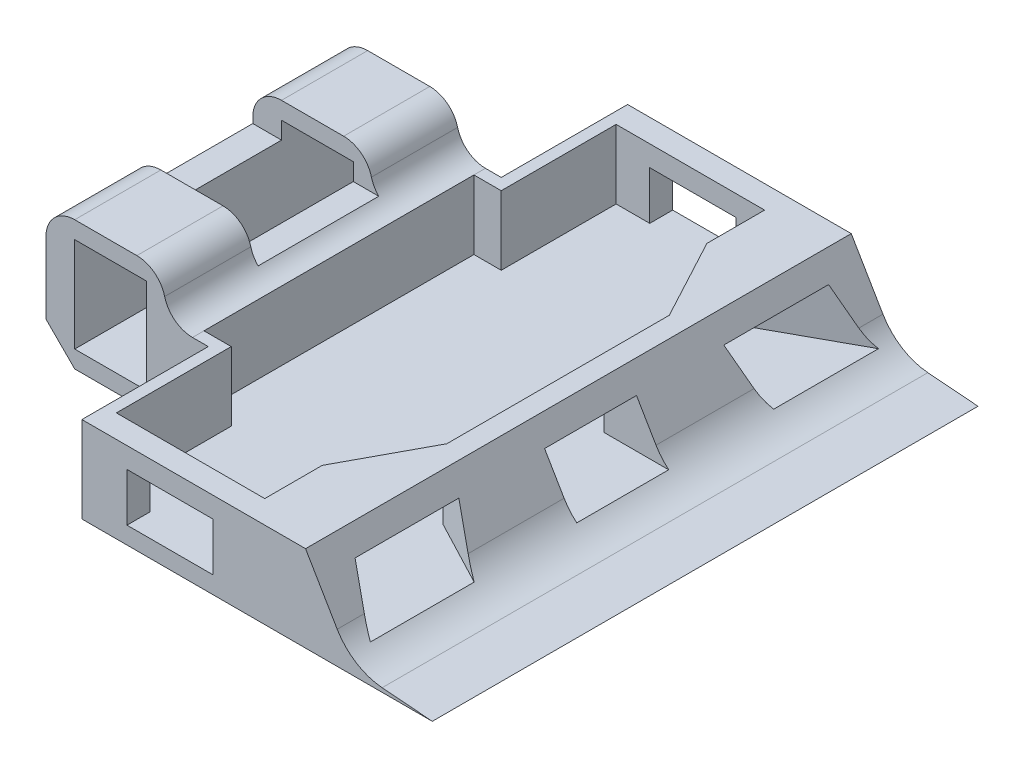
from build123d import *

# Parameters (mm, degrees)
SKETCH1_W                = 95
SKETCH1_H                = 95
BOSS_EXTRUDE1_DEPTH      = 20
SKETCH2_W                = 15
SKETCH2_H                = 8.4
CUT_EXTRUDE1_DEPTH       = 50
CUT_EXTRUDE3_DEPTH       = 100
FILLET1_R                = 10
CUT_EXTRUDE4_DEPTH       = 17
SKETCH8_W                = 15
SKETCH8_H                = 8.4
CUT_EXTRUDE5_DEPTH       = 4
SKETCH9_W                = 15
SKETCH9_H                = 8.4
CUT_EXTRUDE6_DEPTH       = 4
SKETCH10_W               = 15
SKETCH10_H               = 8.4
CUT_EXTRUDE7_DEPTH       = 100
SKETCH11_W               = 15
SKETCH11_H               = 8.4
CUT_EXTRUDE8_DEPTH       = 100
SKETCH12_W               = 96.22761595
SKETCH12_H               = 5
CUT_EXTRUDE9_DEPTH       = 100
SKETCH14_W               = 16
SKETCH14_H               = 8.4
CUT_EXTRUDE10_DEPTH      = 100
SKETCH15_W               = 16
SKETCH15_H               = 8.4
CUT_EXTRUDE11_DEPTH      = 100
SKETCH16_W               = 16
SKETCH16_H               = 8.4
CUT_EXTRUDE13_DEPTH      = 100
CUT_EXTRUDE16_DEPTH      = 12
SKETCH21_W               = 23.779532914
SKETCH21_H               = 2
BOSS_EXTRUDE2_DEPTH      = 12
SKETCH23_W               = 23.759878039
SKETCH23_H               = 2
BOSS_EXTRUDE3_DEPTH      = 12
CUT_EXTRUDE19_DEPTH      = 100
CUT_EXTRUDE19_DEPTH_BACK = 100
SKETCH24_W               = 15
SKETCH24_H               = 8.4
SKETCH26_W               = 20
SKETCH26_H               = 95
BOSS_EXTRUDE4_DEPTH      = 20
SKETCH31_W               = 95
SKETCH31_H               = 20
BOSS_EXTRUDE6_DEPTH      = 10
SKETCH32_W               = 12.5
SKETCH32_H               = 16.5
CUT_EXTRUDE22_DEPTH      = 100
SKETCH33_W               = 3.75
SKETCH33_H               = 20
CUT_EXTRUDE23_DEPTH      = 100
SKETCH34_W               = 26.25
SKETCH34_H               = 12.5
CUT_EXTRUDE24_DEPTH      = 100
SKETCH35_W               = 34
SKETCH35_H               = 47.07285681
CUT_EXTRUDE25_DEPTH      = 22
SKETCH36_W               = 34
SKETCH36_H               = 30.604426896
CUT_EXTRUDE26_DEPTH      = 22
SKETCH37_W               = 26.25
SKETCH37_H               = 21
CUT_EXTRUDE28_DEPTH      = 6
SKETCH38_W               = 5.75
SKETCH38_H               = 22.5
CUT_EXTRUDE29_DEPTH      = 100
CHAMFER1_SIZE            = 5
SKETCH39_W               = 2.070576792
SKETCH39_H               = 87
CUT_EXTRUDE30_DEPTH      = 12
FILLET4_R                = 5
FILLET5_R                = 5
SKETCH40_W               = 4.75
SKETCH40_H               = 47
CUT_EXTRUDE31_DEPTH      = 12
FILLET6_R                = 5


with BuildPart() as part:
    # Sketch1 → Boss-Extrude1 (new body)
    with BuildSketch(Plane(origin=(0, 0, 0), x_dir=(1, 0, 0), z_dir=(0, 1, 0))):
        with Locations((-2.165031067, 2.677660124)):
            Rectangle(SKETCH1_W, SKETCH1_H)
    extrude(amount=BOSS_EXTRUDE1_DEPTH)

    # Sketch2 → Cut-Extrude1 (cut)
    with BuildSketch(Plane(origin=(45.334968933, 0, 0), x_dir=(0, 0, -1), z_dir=(1, 0, 0))):
        with Locations((2.677660124, 7.2)):
            Rectangle(SKETCH2_W, SKETCH2_H)
    extrude(amount=-CUT_EXTRUDE1_DEPTH, mode=Mode.SUBTRACT)

    # Sketch6 → Cut-Extrude3 (cut)
    with BuildSketch(Plane.XY.offset(44.822339876)):
        Polygon((45.334968933, 0), (31.416327077, 1.119733542), (20.334968933, 20), (45.334968933, 20), align=None)
    extrude(amount=-CUT_EXTRUDE3_DEPTH, mode=Mode.SUBTRACT)

    # Fillet1
    # the kernel refuses this fillet: 10 mm, written as the material it adds along each edge
    with BuildSketch(Plane(origin=(31.416327077, 1.119733542, 44.822339876), x_dir=(0.9967796443594351, -0.08018940447888392, 0), z_dir=(0, 0, -1))) as fillet1_piece_1_section:
        with BuildLine():
            CenterArc((FILLET1_R * 0.52046366993, -FILLET1_R), FILLET1_R, 90, 54.990678882)
            Line((-FILLET1_R * 0.298595051697, -FILLET1_R * 0.426290308146), (0, 0))
            Line((0, 0), (FILLET1_R * 0.52046366993, 0))
        make_face()
    fillet1_piece_1 = extrude(amount=95, mode=Mode.PRIVATE)
    fillet1_piece_1 = split(fillet1_piece_1, bisect_by=Plane(origin=(32.462514907, 1.548685907, 4.822339876), z_dir=(0, 0, 1)), keep=Keep.TOP, mode=Mode.PRIVATE)
    fillet1_piece_1 = split(fillet1_piece_1, bisect_by=Plane(origin=(32.462514907, 3, 24.822339876), z_dir=(0, -1, 0)), keep=Keep.TOP, mode=Mode.PRIVATE)
    add(fillet1_piece_1)
    with BuildSketch(Plane(origin=(31.416327077, 1.119733542, 44.822339876), x_dir=(0.9967796443594351, -0.08018940447888392, 0), z_dir=(0, 0, -1))) as fillet1_piece_2_section:
        with BuildLine():
            CenterArc((FILLET1_R * 0.52046366993, -FILLET1_R), FILLET1_R, 90, 54.990678882)
            Line((-FILLET1_R * 0.298595051697, -FILLET1_R * 0.426290308146), (0, 0))
            Line((0, 0), (FILLET1_R * 0.52046366993, 0))
        make_face()
    fillet1_piece_2 = extrude(amount=95, mode=Mode.PRIVATE)
    fillet1_piece_2 = split(fillet1_piece_2, bisect_by=Plane(origin=(29.780943428, 3.965739863, 4.822339876), z_dir=(0, 0, 1)), keep=Keep.TOP, mode=Mode.PRIVATE)
    fillet1_piece_2 = split(fillet1_piece_2, bisect_by=Plane(origin=(29.780943428, 3, 24.822339876), z_dir=(0, 1, 0)), keep=Keep.TOP, mode=Mode.PRIVATE)
    add(fillet1_piece_2)
    with BuildSketch(Plane(origin=(31.416327077, 1.119733542, 44.822339876), x_dir=(0.9967796443594351, -0.08018940447888392, 0), z_dir=(0, 0, -1))) as fillet1_piece_3_section:
        with BuildLine():
            CenterArc((FILLET1_R * 0.52046366993, -FILLET1_R), FILLET1_R, 90, 54.990678882)
            Line((-FILLET1_R * 0.298595051697, -FILLET1_R * 0.426290308146), (0, 0))
            Line((0, 0), (FILLET1_R * 0.52046366993, 0))
        make_face()
    fillet1_piece_3 = extrude(amount=95, mode=Mode.PRIVATE)
    fillet1_piece_3 = split(fillet1_piece_3, bisect_by=Plane(origin=(32.462514907, 1.548685907, -10.177660124), z_dir=(0, 0, 1)), keep=Keep.TOP, mode=Mode.PRIVATE)
    fillet1_piece_3 = split(fillet1_piece_3, bisect_by=Plane(origin=(32.462514907, 1.548685907, 4.822339876), z_dir=(0, 0, -1)), keep=Keep.TOP, mode=Mode.PRIVATE)
    fillet1_piece_3 = split(fillet1_piece_3, bisect_by=Plane(origin=(32.462514907, 3, -2.677660124), z_dir=(0, -1, 0)), keep=Keep.TOP, mode=Mode.PRIVATE)
    add(fillet1_piece_3)
    with BuildSketch(Plane(origin=(31.416327077, 1.119733542, 44.822339876), x_dir=(0.9967796443594351, -0.08018940447888392, 0), z_dir=(0, 0, -1))) as fillet1_piece_4_section:
        with BuildLine():
            CenterArc((FILLET1_R * 0.52046366993, -FILLET1_R), FILLET1_R, 90, 54.990678882)
            Line((-FILLET1_R * 0.298595051697, -FILLET1_R * 0.426290308146), (0, 0))
            Line((0, 0), (FILLET1_R * 0.52046366993, 0))
        make_face()
    fillet1_piece_4 = extrude(amount=95, mode=Mode.PRIVATE)
    fillet1_piece_4 = split(fillet1_piece_4, bisect_by=Plane(origin=(32.462514907, 1.548685907, -10.177660124), z_dir=(0, 0, -1)), keep=Keep.TOP, mode=Mode.PRIVATE)
    fillet1_piece_4 = split(fillet1_piece_4, bisect_by=Plane(origin=(32.462514907, 3, -30.177660124), z_dir=(0, -1, 0)), keep=Keep.TOP, mode=Mode.PRIVATE)
    add(fillet1_piece_4)
    with BuildSketch(Plane(origin=(31.416327077, 1.119733542, 44.822339876), x_dir=(0.9967796443594351, -0.08018940447888392, 0), z_dir=(0, 0, -1))) as fillet1_piece_5_section:
        with BuildLine():
            CenterArc((FILLET1_R * 0.52046366993, -FILLET1_R), FILLET1_R, 90, 54.990678882)
            Line((-FILLET1_R * 0.298595051697, -FILLET1_R * 0.426290308146), (0, 0))
            Line((0, 0), (FILLET1_R * 0.52046366993, 0))
        make_face()
    fillet1_piece_5 = extrude(amount=95, mode=Mode.PRIVATE)
    fillet1_piece_5 = split(fillet1_piece_5, bisect_by=Plane(origin=(29.780943428, 3.965739863, -10.177660124), z_dir=(0, 0, -1)), keep=Keep.TOP, mode=Mode.PRIVATE)
    fillet1_piece_5 = split(fillet1_piece_5, bisect_by=Plane(origin=(29.780943428, 3, -30.177660124), z_dir=(0, 1, 0)), keep=Keep.TOP, mode=Mode.PRIVATE)
    add(fillet1_piece_5)

    # Sketch7 → Cut-Extrude4 (cut)
    with BuildSketch(Plane(origin=(0, 20, 0), x_dir=(1, 0, 0), z_dir=(0, 1, 0))):
        Polygon((11.360713437, -29.822339876), (18.334968933, -16.542288661), (9.481601456, -11.892784997), (2.50734596, -25.172836212), align=None)
        Polygon((18.334968933, 22.020257336), (11.132000664, 35.177660124), (2.360398805, 30.375681278), (9.563367074, 17.21827849), align=None)
    extrude(amount=-CUT_EXTRUDE4_DEPTH, mode=Mode.SUBTRACT)

    # Sketch8 → Cut-Extrude5 (cut)
    with BuildSketch(Plane(origin=(12.327397833, 0, 6.473952599), x_dir=(0.4649503663833249, 0, -0.885336747684186), z_dir=(0.8853367476841859, 0, 0.4649503663833248))):
        with Locations((-13.620645519, 7.2)):
            Rectangle(SKETCH8_W, SKETCH8_H)
    extrude(amount=-CUT_EXTRUDE5_DEPTH, mode=Mode.SUBTRACT)

    # Sketch9 → Cut-Extrude6 (cut)
    with BuildSketch(Plane(origin=(14.610669282, 0, -7.99855328), x_dir=(-0.48019788460400603, 0, -0.8771601858394155), z_dir=(0.8771601858394155, 0, -0.48019788460400603))):
        with Locations((18.010879722, 7.2)):
            Rectangle(SKETCH9_W, SKETCH9_H)
    extrude(amount=-CUT_EXTRUDE6_DEPTH, mode=Mode.SUBTRACT)

    # Sketch10 → Cut-Extrude7 (cut)
    with BuildSketch(Plane(origin=(8.786050842, 0, 4.614151134), x_dir=(0.464950366383325, 0, -0.8853367476841859), z_dir=(0.8853367476841859, 0, 0.464950366383325))):
        with Locations((-13.620645519, 7.2)):
            Rectangle(SKETCH10_W, SKETCH10_H)
    extrude(amount=CUT_EXTRUDE7_DEPTH, mode=Mode.SUBTRACT)

    # Sketch11 → Cut-Extrude8 (cut)
    with BuildSketch(Plane(origin=(11.102028539, 0, -6.077761742), x_dir=(-0.48019788460400603, 0, -0.8771601858394155), z_dir=(0.8771601858394155, 0, -0.48019788460400603))):
        with Locations((18.010879722, 7.2)):
            Rectangle(SKETCH11_W, SKETCH11_H)
    extrude(amount=CUT_EXTRUDE8_DEPTH, mode=Mode.SUBTRACT)

    # Sketch12 → Cut-Extrude9 (cut)
    with BuildSketch(Plane.XY.offset(44.822339876)):
        with Locations((-1.551223092, 17.5)):
            Rectangle(SKETCH12_W, SKETCH12_H)
    extrude(amount=-CUT_EXTRUDE9_DEPTH, mode=Mode.SUBTRACT)

    # Sketch14 → Cut-Extrude10 (cut)
    with BuildSketch(Plane(origin=(11.102028539, 0, -6.077761742), x_dir=(-0.48019788460400603, 0, -0.8771601858394155), z_dir=(0.8771601858394155, 0, -0.48019788460400603))):
        with Locations((18.510879722, 7.2)):
            Rectangle(SKETCH14_W, SKETCH14_H)
    extrude(amount=CUT_EXTRUDE10_DEPTH, mode=Mode.SUBTRACT)

    # Sketch15 → Cut-Extrude11 (cut)
    with BuildSketch(Plane(origin=(8.786050842, 0, 4.614151134), x_dir=(0.464950366383325, 0, -0.8853367476841859), z_dir=(0.8853367476841859, 0, 0.464950366383325))):
        with Locations((-14.120645519, 7.2)):
            Rectangle(SKETCH15_W, SKETCH15_H)
    extrude(amount=CUT_EXTRUDE11_DEPTH, mode=Mode.SUBTRACT)

    # Sketch16 → Cut-Extrude13 (cut)
    with BuildSketch(Plane(origin=(-4.665031067, 0, 0), x_dir=(0, 0, -1), z_dir=(1, 0, 0))):
        with Locations((2.677660124, 7.2)):
            Rectangle(SKETCH16_W, SKETCH16_H)
    extrude(amount=CUT_EXTRUDE13_DEPTH, mode=Mode.SUBTRACT)

    # Sketch19 → Cut-Extrude16 (cut)
    with BuildSketch(Plane(origin=(0, 15, 0), x_dir=(1, 0, 0), z_dir=(0, 1, 0))):
        Polygon((12.165423764, -30.809704699), (19.747212292, -16.720116958), (19.744163962, 22.025988312), (12.185078639, 36.127769372), (12.185078639, 48.177660124), (-11.594454275, 48.177660124), (-11.594454275, -42.822339876), (12.165423764, -42.822339876), align=None)
    extrude(amount=-CUT_EXTRUDE16_DEPTH, mode=Mode.SUBTRACT)

    # Sketch21 → Boss-Extrude2 (add)
    with BuildSketch(Plane(origin=(0, 3, 0), x_dir=(1, 0, 0), z_dir=(0, 1, 0))):
        with Locations((0.295312182, 47.177660124)):
            Rectangle(SKETCH21_W, SKETCH21_H)
    extrude(amount=BOSS_EXTRUDE2_DEPTH)

    # Sketch23 → Boss-Extrude3 (add)
    with BuildSketch(Plane(origin=(0, 3, 0), x_dir=(1, 0, 0), z_dir=(0, 1, 0))):
        with Locations((0.285484745, -41.822339876)):
            Rectangle(SKETCH23_W, SKETCH23_H)
    extrude(amount=BOSS_EXTRUDE3_DEPTH)

    # Sketch24 → Cut-Extrude19 (cut, two sides: drawn at the far end of the back side and taken through both)
    with BuildSketch(Plane.XY.offset(-46.177660124).offset(-CUT_EXTRUDE19_DEPTH_BACK)):
        with Locations((-0.314454275, 7.2)):
            Rectangle(SKETCH24_W, SKETCH24_H)
    extrude(amount=CUT_EXTRUDE19_DEPTH + CUT_EXTRUDE19_DEPTH_BACK, mode=Mode.SUBTRACT)

    # Sketch26 → Boss-Extrude4 (add)
    with BuildSketch(Plane(origin=(0, 15, 0), x_dir=(1, 0, 0), z_dir=(0, 1, 0))):
        with Locations((-39.665031067, 2.677660124)):
            Rectangle(SKETCH26_W, SKETCH26_H)
    extrude(amount=BOSS_EXTRUDE4_DEPTH)

    # Sketch31 → Boss-Extrude6 (add)
    with BuildSketch(Plane(origin=(-29.665031067, 0, 0), x_dir=(0, 0, -1), z_dir=(1, 0, 0))):
        with Locations((2.677660124, 25)):
            Rectangle(SKETCH31_W, SKETCH31_H)
    extrude(amount=BOSS_EXTRUDE6_DEPTH)

    # Sketch32 → Cut-Extrude22 (cut)
    with BuildSketch(Plane(origin=(0, 0, -50.177660124), x_dir=(-1, 0, 0), z_dir=(0, 0, -1))):
        with Locations((32.665031067, 11.25)):
            Rectangle(SKETCH32_W, SKETCH32_H)
    extrude(amount=-CUT_EXTRUDE22_DEPTH, mode=Mode.SUBTRACT)

    # Sketch33 → Cut-Extrude23 (cut)
    with BuildSketch(Plane(origin=(0, 0, -50.177660124), x_dir=(-1, 0, 0), z_dir=(0, 0, -1))):
        with Locations((21.540031067, 25)):
            Rectangle(SKETCH33_W, SKETCH33_H)
    extrude(amount=-CUT_EXTRUDE23_DEPTH, mode=Mode.SUBTRACT)

    # Sketch34 → Cut-Extrude24 (cut)
    with BuildSketch(Plane(origin=(0, 0, -50.177660124), x_dir=(-1, 0, 0), z_dir=(0, 0, -1))):
        with Locations((36.540031067, 28.75)):
            Rectangle(SKETCH34_W, SKETCH34_H)
    extrude(amount=-CUT_EXTRUDE24_DEPTH, mode=Mode.SUBTRACT)

    # Sketch35 → Cut-Extrude25 (cut)
    with BuildSketch(Plane(origin=(0, 0, -50.177660124), x_dir=(-1, 0, 0), z_dir=(0, 0, -1))):
        with Locations((32.665031067, 23.536428405)):
            Rectangle(SKETCH35_W, SKETCH35_H)
    extrude(amount=-CUT_EXTRUDE25_DEPTH, mode=Mode.SUBTRACT)

    # Sketch36 → Cut-Extrude26 (cut)
    with BuildSketch(Plane.XY.offset(44.822339876)):
        with Locations((-32.665031067, 15.302213448)):
            Rectangle(SKETCH36_W, SKETCH36_H)
    extrude(amount=-CUT_EXTRUDE26_DEPTH, mode=Mode.SUBTRACT)

    # Sketch37 → Cut-Extrude28 (cut)
    with BuildSketch(Plane(origin=(0, 22.5, 0), x_dir=(1, 0, 0), z_dir=(0, 1, 0))):
        with Locations((-36.540031067, 2.677660124)):
            Rectangle(SKETCH37_W, SKETCH37_H)
    extrude(amount=-CUT_EXTRUDE28_DEPTH, mode=Mode.SUBTRACT)

    # Sketch38 → Cut-Extrude29 (cut)
    with BuildSketch(Plane.XY.offset(22.822339876)):
        with Locations((-46.790031067, 11.25)):
            Rectangle(SKETCH38_W, SKETCH38_H)
    extrude(amount=-CUT_EXTRUDE29_DEPTH, mode=Mode.SUBTRACT)

    # Chamfer1
    chamfer1_edges = [part.edges().sort_by_distance(p)[0] for p in [
        (-43.915031067, 0, -2.677660124),
    ]]
    chamfer(chamfer1_edges, length=CHAMFER1_SIZE)

    # Sketch39 → Cut-Extrude30 (cut)
    with BuildSketch(Plane(origin=(0, 15, 0), x_dir=(1, 0, 0), z_dir=(0, 1, 0))):
        with Locations((-12.629742671, 2.677660124)):
            Rectangle(SKETCH39_W, SKETCH39_H)
    extrude(amount=-CUT_EXTRUDE30_DEPTH, mode=Mode.SUBTRACT)

    # Fillet4
    # the kernel refuses this fillet: 5 mm, written as the material it adds along each edge
    with BuildSketch(Plane(origin=(-23.415031067, 15, -28.177660124), x_dir=(1, 0, 0), z_dir=(0, 0, 1))) as fillet4_piece_1_section:
        with BuildLine():
            CenterArc((FILLET4_R, FILLET4_R), FILLET4_R, 180, 90)
            Line((0, FILLET4_R), (0, 0))
            Line((0, 0), (FILLET4_R, 0))
        make_face()
    fillet4_piece_1 = extrude(amount=51, mode=Mode.PRIVATE)
    fillet4_piece_1 = split(fillet4_piece_1, bisect_by=Plane(origin=(-21.940460429, 15.541584114, -13.177660124), z_dir=(0, 0, -1)), keep=Keep.TOP, mode=Mode.PRIVATE)
    fillet4_piece_1 = split(fillet4_piece_1, bisect_by=Plane(origin=(-21.940460429, 16.5, -20.677660124), z_dir=(0, -1, 0)), keep=Keep.TOP, mode=Mode.PRIVATE)
    add(fillet4_piece_1)
    with BuildSketch(Plane(origin=(-23.415031067, 15, -28.177660124), x_dir=(1, 0, 0), z_dir=(0, 0, 1))) as fillet4_piece_2_section:
        with BuildLine():
            CenterArc((FILLET4_R, FILLET4_R), FILLET4_R, 180, 90)
            Line((0, FILLET4_R), (0, 0))
            Line((0, 0), (FILLET4_R, 0))
        make_face()
    fillet4_piece_2 = extrude(amount=51, mode=Mode.PRIVATE)
    fillet4_piece_2 = split(fillet4_piece_2, bisect_by=Plane(origin=(-23.084676974, 17.513403735, -13.177660124), z_dir=(0, 0, -1)), keep=Keep.TOP, mode=Mode.PRIVATE)
    fillet4_piece_2 = split(fillet4_piece_2, bisect_by=Plane(origin=(-23.084676974, 16.5, -20.677660124), z_dir=(0, 1, 0)), keep=Keep.TOP, mode=Mode.PRIVATE)
    add(fillet4_piece_2)
    with BuildSketch(Plane(origin=(-23.415031067, 15, -28.177660124), x_dir=(1, 0, 0), z_dir=(0, 0, 1))) as fillet4_piece_3_section:
        with BuildLine():
            CenterArc((FILLET4_R, FILLET4_R), FILLET4_R, 180, 90)
            Line((0, FILLET4_R), (0, 0))
            Line((0, 0), (FILLET4_R, 0))
        make_face()
    fillet4_piece_3 = extrude(amount=51, mode=Mode.PRIVATE)
    fillet4_piece_3 = split(fillet4_piece_3, bisect_by=Plane(origin=(-21.940460429, 15.541584114, -13.177660124), z_dir=(0, 0, 1)), keep=Keep.TOP, mode=Mode.PRIVATE)
    fillet4_piece_3 = split(fillet4_piece_3, bisect_by=Plane(origin=(-21.940460429, 16.5, -2.677660124), z_dir=(0, -1, 0)), keep=Keep.TOP, mode=Mode.PRIVATE)
    fillet4_piece_3 = split(fillet4_piece_3, bisect_by=Plane(origin=(-21.940460429, 15.541584114, 7.822339876), z_dir=(0, 0, -1)), keep=Keep.TOP, mode=Mode.PRIVATE)
    add(fillet4_piece_3)
    with BuildSketch(Plane(origin=(-23.415031067, 15, -28.177660124), x_dir=(1, 0, 0), z_dir=(0, 0, 1))) as fillet4_piece_4_section:
        with BuildLine():
            CenterArc((FILLET4_R, FILLET4_R), FILLET4_R, 180, 90)
            Line((0, FILLET4_R), (0, 0))
            Line((0, 0), (FILLET4_R, 0))
        make_face()
    fillet4_piece_4 = extrude(amount=51, mode=Mode.PRIVATE)
    fillet4_piece_4 = split(fillet4_piece_4, bisect_by=Plane(origin=(-21.940460429, 16.5, 15.322339876), z_dir=(0, -1, 0)), keep=Keep.TOP, mode=Mode.PRIVATE)
    fillet4_piece_4 = split(fillet4_piece_4, bisect_by=Plane(origin=(-21.940460429, 15.541584114, 7.822339876), z_dir=(0, 0, 1)), keep=Keep.TOP, mode=Mode.PRIVATE)
    add(fillet4_piece_4)
    with BuildSketch(Plane(origin=(-23.415031067, 15, -28.177660124), x_dir=(1, 0, 0), z_dir=(0, 0, 1))) as fillet4_piece_5_section:
        with BuildLine():
            CenterArc((FILLET4_R, FILLET4_R), FILLET4_R, 180, 90)
            Line((0, FILLET4_R), (0, 0))
            Line((0, 0), (FILLET4_R, 0))
        make_face()
    fillet4_piece_5 = extrude(amount=51, mode=Mode.PRIVATE)
    fillet4_piece_5 = split(fillet4_piece_5, bisect_by=Plane(origin=(-23.084676974, 16.5, 15.322339876), z_dir=(0, 1, 0)), keep=Keep.TOP, mode=Mode.PRIVATE)
    fillet4_piece_5 = split(fillet4_piece_5, bisect_by=Plane(origin=(-23.084676974, 17.513403735, 7.822339876), z_dir=(0, 0, 1)), keep=Keep.TOP, mode=Mode.PRIVATE)
    add(fillet4_piece_5)

    # Fillet5
    fillet5_edges = [part.edges().sort_by_distance(p)[0] for p in [
        (-23.415031067, 22.5, 15.322339876),
        (-23.415031067, 22.5, -20.677660124),
    ]]
    fillet(fillet5_edges, radius=FILLET5_R)

    # Sketch40 → Cut-Extrude31 (cut)
    with BuildSketch(Plane(origin=(0, 15, 0), x_dir=(1, 0, 0), z_dir=(0, 1, 0))):
        with Locations((-16.040031067, 2.677660124)):
            Rectangle(SKETCH40_W, SKETCH40_H)
    extrude(amount=-CUT_EXTRUDE31_DEPTH, mode=Mode.SUBTRACT)

    # Fillet6
    fillet6_edges = [part.edges().sort_by_distance(p)[0] for p in [
        (-43.915031067, 22.5, -20.677660124),
        (-43.915031067, 22.5, 15.322339876),
    ]]
    fillet(fillet6_edges, radius=FILLET6_R)


solid = part.part
